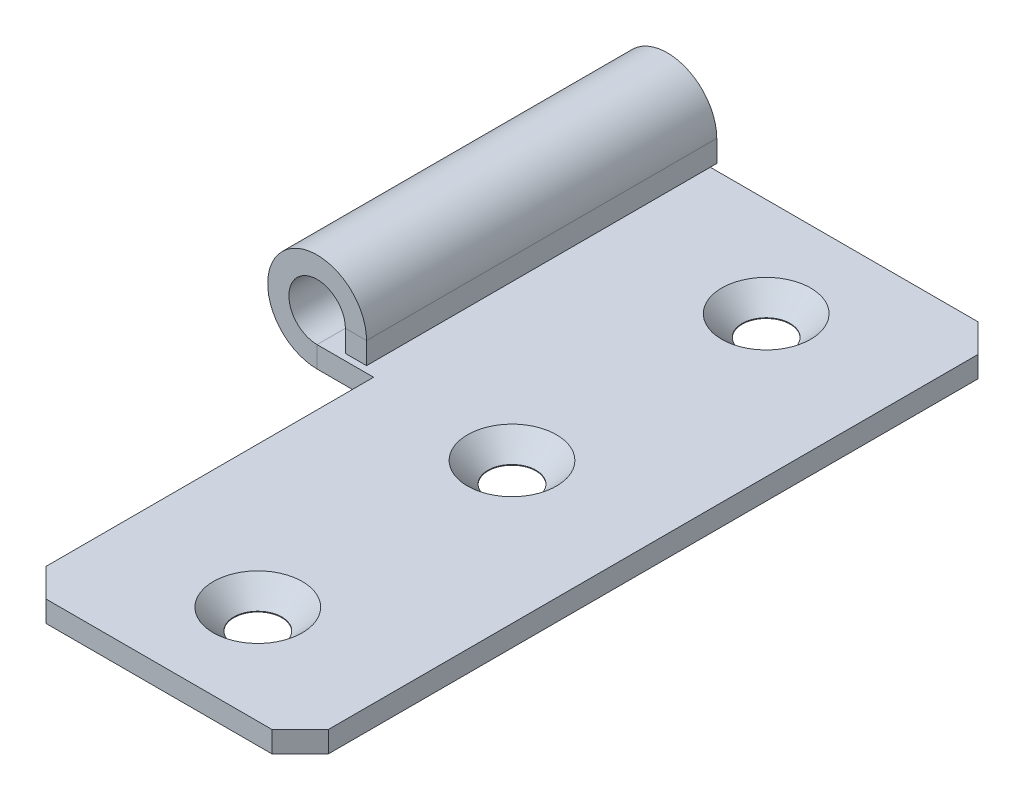
from build123d import *

# Parameters (mm, degrees)
BASE_FLANGE1_DEPTH                           = 1.5
CHAMFER1_SIZE                                = 2
CSK_FOR_M3_COUNTERSUNK_FLAT_HEAD_SCR_2_COUNT = 2
CSK_FOR_M3_COUNTERSUNK_FLAT_HEAD_SCR_2_PITCH = 18
CSK_FOR_M3_COUNTERSUNK_FLAT_HEAD_SCR_3_COUNT = 2
CSK_FOR_M3_COUNTERSUNK_FLAT_HEAD_SCR_3_PITCH = 36
SKETCHED_START                               = -50
SKETCHED_BEND1_DEPTH                         = 24.8
SKETCHED_BEND1_2_DEPTH                       = 24.8


# Read off the part's stored shape, not the designer's step: Sketched Bend1
# Sheet-metal steps are written as plain solids
with BuildPart() as part:
    # Sketch1 → Base-Flange1 (new body)
    with BuildSketch(Plane(origin=(0, 0, 0), x_dir=(1, 0, 0), z_dir=(0, 1, 0))):
        Polygon((-28.5, 50), (10, 50), (10, 0), (-10, 0), (-10, 25.2), (-28.5, 25.2), align=None)
    extrude(amount=-BASE_FLANGE1_DEPTH)

    # Chamfer1
    chamfer1_edges = [part.edges().sort_by_distance(p)[0] for p in [
        (10, -0.75, 0),
        (-10, -0.75, 0),
        (10, -0.75, -50),
    ]]
    chamfer(chamfer1_edges, length=CHAMFER1_SIZE)

    # Sketch7 → CSK for M3 Countersunk Flat Head Screw1 (revolve, cut)
    with BuildSketch(Plane(origin=(0, 0, -43), x_dir=(0, 0, 1), z_dir=(1, 0, 0))):
        Polygon((0, 0), (0, 1.5), (1.7, 1.5), (1.7, 1.45), (3.15, 0), align=None)
    csk_for_m3_countersunk_flat_head_screw1 = revolve(axis=Axis((0, 6.35, -43), (0, -1, 0)), mode=Mode.SUBTRACT)

    # CSK for M3 Countersunk Flat Head Scr 2: CSK for M3 Countersunk Flat Head Screw1 ×2
    with Locations(*[(0, 0, i * CSK_FOR_M3_COUNTERSUNK_FLAT_HEAD_SCR_2_PITCH) for i in range(1, CSK_FOR_M3_COUNTERSUNK_FLAT_HEAD_SCR_2_COUNT)]):
        add(csk_for_m3_countersunk_flat_head_screw1, mode=Mode.SUBTRACT)

    # CSK for M3 Countersunk Flat Head Scr 3: CSK for M3 Countersunk Flat Head Screw1 ×2
    with Locations(*[(0, 0, i * CSK_FOR_M3_COUNTERSUNK_FLAT_HEAD_SCR_3_PITCH) for i in range(1, CSK_FOR_M3_COUNTERSUNK_FLAT_HEAD_SCR_3_COUNT)]):
        add(csk_for_m3_countersunk_flat_head_screw1, mode=Mode.SUBTRACT)

    # Sketched Bend1 outline → Sketched Bend1 (cut)
    with BuildSketch(Plane.XY.offset(SKETCHED_START)):
        with BuildLine():
            ThreePointArc((-14, -1.5), (-15.620185175, -1.102418411), (-16.872281323, 0))
            Line((-16.872281323, 0), (-28.5, 0))
            Line((-28.5, 0), (-28.5, -1.5))
            Line((-28.5, -1.5), (-14, -1.5))
        make_face()
    extrude(amount=SKETCHED_BEND1_DEPTH, mode=Mode.SUBTRACT)

    # Sketched Bend1 2 outline → Sketched Bend1 2 (add)
    with BuildSketch(Plane.XY.offset(SKETCHED_START)):
        with BuildLine():
            Line((-10.5, 0.459069696), (-10.5, 2))
            ThreePointArc((-10.5, 2), (-15.048097173, 5.33938502), (-16.872281323, 0))
            Line((-16.872281323, 0), (-14, 0))
            ThreePointArc((-14, 0), (-15.414213562, 3.414213562), (-12, 2))
            Line((-12, 2), (-12, 0.459069696))
            Line((-12, 0.459069696), (-10.5, 0.459069696))
        make_face()
    extrude(amount=SKETCHED_BEND1_2_DEPTH)


solid = part.part
